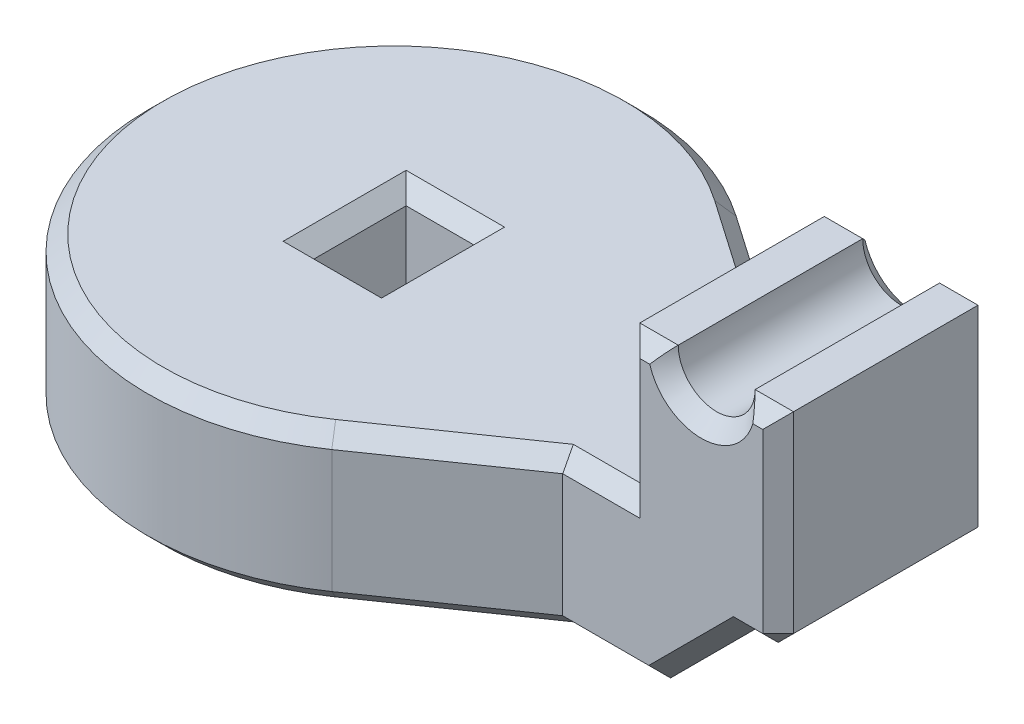
from build123d import *

# Parameters (mm, degrees)
SKETCH1_W           = 2.2
SKETCH1_H           = 3
BOSS_EXTRUDE1_DEPTH = 5
SKETCH3_W           = 5
SKETCH3_H           = 7
BOSS_EXTRUDE2_DEPTH = 1.5
SKETCH6_W           = 4
SKETCH6_H           = 7
CUT_EXTRUDE1_DEPTH  = 2.75
CHAMFER2_SIZE       = 2.75
SKETCH7_W           = 5
SKETCH7_H           = 7
BOSS_EXTRUDE3_DEPTH = 3
CUT_EXTRUDE2_DEPTH  = 21.32855135
BOSS_EXTRUDE4_START = -5
BOSS_EXTRUDE4_DEPTH = 5


# Some blends are built 0.0001 mm under size
with BuildPart() as part:
    # Sketch1 → Boss-Extrude1 (new body)
    with BuildSketch(Plane(origin=(0, 0, 0), x_dir=(1, 0, 0), z_dir=(0, 1, 0))):
        with BuildLine():
            Line((7.193747285, 3.5), (16, 3.5))
            Line((16, 3.5), (16, -3.5))
            Line((16, -3.5), (7.193747285, -3.5))
            ThreePointArc((7.193747285, -3.5), (-8, 0), (7.193747285, 3.5))
        make_face()
        Rectangle(SKETCH1_W, SKETCH1_H, mode=Mode.SUBTRACT)
    extrude(amount=-BOSS_EXTRUDE1_DEPTH)

    # Sketch3 → Boss-Extrude2 (add)
    with BuildSketch(Plane(origin=(0, 0, 0), x_dir=(1, 0, 0), z_dir=(0, 1, 0))):
        with Locations((13.5, 0)):
            Rectangle(SKETCH3_W, SKETCH3_H)
    extrude(amount=BOSS_EXTRUDE2_DEPTH)

    # Sketch6 → Cut-Extrude1 (cut)
    with BuildSketch(Plane.XZ.offset(5)):
        with Locations((14, 0)):
            Rectangle(SKETCH6_W, SKETCH6_H)
    extrude(amount=-CUT_EXTRUDE1_DEPTH, mode=Mode.SUBTRACT)

    # Chamfer2
    chamfer2_edges = [part.edges().sort_by_distance(p)[0] for p in [
        (12, -2.25, 0),
    ]]
    chamfer(chamfer2_edges, length=CHAMFER2_SIZE - 0.0001)  # a hair under: the kernel refuses the full size

    # Sketch7 → Boss-Extrude3 (add)
    with BuildSketch(Plane(origin=(0, 1.5, 0), x_dir=(1, 0, 0), z_dir=(0, 1, 0))):
        with Locations((13.5, 0)):
            Rectangle(SKETCH7_W, SKETCH7_H)
    extrude(amount=BOSS_EXTRUDE3_DEPTH)

    # Sketch8 → Cut-Extrude2 (cut, through all)
    with BuildSketch(Plane(origin=(0, 0, -3.5), x_dir=(-1, 0, 0), z_dir=(0, 0, -1))):
        with BuildLine():
            Line((-12.25, 4.5), (-14.75, 4.5))
            ThreePointArc((-14.75, 4.5), (-13.5, 3.25), (-12.25, 4.5))
        make_face()
    extrude(amount=-CUT_EXTRUDE2_DEPTH, mode=Mode.SUBTRACT)

    # Sketch9 → Boss-Extrude4 (add)
    with BuildSketch(Plane.XZ.offset(5).offset(BOSS_EXTRUDE4_START)):
        with BuildLine():
            Line((7.193747285, -3.5), (8.993747285, -3.5))
            Line((8.993747285, -3.5), (4.557329118, -6.575009605))
            ThreePointArc((4.557329118, -6.575009605), (6.073373871, -5.207122989), (7.193747285, -3.5))
        make_face()
        with BuildLine():
            Line((7.193747285, 3.5), (8.993747285, 3.5))
            Line((8.993747285, 3.5), (4.557329118, 6.575009605))
            ThreePointArc((4.557329118, 6.575009605), (6.073373871, 5.207122989), (7.193747285, 3.5))
        make_face()
    extrude(amount=BOSS_EXTRUDE4_DEPTH)

    # Chamfer3
    # the kernel refuses this chamfer: 0.5 mm, written as the material it takes off along each edge
    with BuildSketch(Plane(origin=(15.666666667, -1.916666667, 3.166666667), x_dir=(-0.7071067811865475, -0.7071067811865475, 0), z_dir=(0.5773502691896256, -0.5773502691896261, 0.5773502691896256))) as chamfer3_piece_1:
        Polygon((-0.353553391, 0.204124145), (0.353553391, 0.204124145), (0, -0.40824829), align=None)
    extrude(amount=0.635085296, mode=Mode.SUBTRACT)
    with BuildSketch(Plane(origin=(15.666666667, -1.916666667, -3.166666667), x_dir=(0.7071067811865478, 0, 0.7071067811865471), z_dir=(0.5773502691896256, -0.5773502691896256, -0.5773502691896261))) as chamfer3_piece_2:
        Polygon((-0.353553391, -0.204124145), (0.353553391, -0.204124145), (0, 0.40824829), align=None)
    extrude(amount=0.635085296, mode=Mode.SUBTRACT)
    with BuildSketch(Plane(origin=(-1.1, -5, 1.5), x_dir=(-0.9996219169112968, -0.027495876610585633, 0), z_dir=(0, 0, -1)), Plane(origin=(1.1, -5, -1.5), x_dir=(0.9996219169112968, -0.027495876610585633, 0), z_dir=(0, 0, 1))) as chamfer3_piece_3:
        with BuildLine():
            Line((0.514336598, 0), (-0.028273577, 0.513558897))
            Line((-0.028273577, 0.513558897), (-0.038269797, 0.513283938))
            ThreePointArc((-0.038269797, 0.513283938), (-0.017064614, 0.256698915), (-0.009996219, -0.000274959))
            Line((-0.009996219, -0.000274959), (0.000274959, -0.009996219))
            ThreePointArc((0.000274959, -0.009996219), (0.257248832, -0.002927825), (0.514611556, -0.009996219))
            Line((0.514611556, -0.009996219), (0.514336598, 0))
        make_face()
    extrude(amount=3, mode=Mode.SUBTRACT)
    with BuildSketch(Plane(origin=(-1.1, -5, -1.5), x_dir=(0, -0.027495876610585623, -0.9996219169112968), z_dir=(1, 0, 0)), Plane(origin=(1.1, -5, 1.5), x_dir=(0, -0.027495876610585623, 0.9996219169112968), z_dir=(-1, 0, 0))) as chamfer3_piece_4:
        with BuildLine():
            Line((0.514336598, 0), (-0.028273577, 0.513558897))
            Line((-0.028273577, 0.513558897), (-0.038269797, 0.513283938))
            ThreePointArc((-0.038269797, 0.513283938), (-0.017064614, 0.256698915), (-0.009996219, -0.000274959))
            Line((-0.009996219, -0.000274959), (0.000274959, -0.009996219))
            ThreePointArc((0.000274959, -0.009996219), (0.257248832, -0.002927825), (0.514611556, -0.009996219))
            Line((0.514611556, -0.009996219), (0.514336598, 0))
        make_face()
    extrude(amount=2.2, mode=Mode.SUBTRACT)
    with BuildSketch(Plane(origin=(-1.1, 0, 1.5), x_dir=(-0.9996219169112968, 0.027495876610586386, 0), z_dir=(0, 0, -1)), Plane(origin=(1.1, 0, -1.5), x_dir=(0.9996219169112968, 0.027495876610586386, 0), z_dir=(0, 0, 1))) as chamfer3_piece_5:
        with BuildLine():
            Line((0.514336598, 0), (-0.028273577, -0.513558897))
            Line((-0.028273577, -0.513558897), (-0.038269797, -0.513283938))
            ThreePointArc((-0.038269797, -0.513283938), (-0.017064614, -0.256698915), (-0.009996219, 0.000274959))
            Line((-0.009996219, 0.000274959), (0.000274959, 0.009996219))
            ThreePointArc((0.000274959, 0.009996219), (0.257248832, 0.002927825), (0.514611556, 0.009996219))
            Line((0.514611556, 0.009996219), (0.514336598, 0))
        make_face()
    extrude(amount=3, mode=Mode.SUBTRACT)
    with BuildSketch(Plane(origin=(1.1, 0, 1.5), x_dir=(0, 0.027495876610586365, 0.9996219169112968), z_dir=(-1, 0, 0)), Plane(origin=(-1.1, 0, -1.5), x_dir=(0, 0.027495876610586365, -0.9996219169112968), z_dir=(1, 0, 0))) as chamfer3_piece_6:
        with BuildLine():
            Line((0.514336598, 0), (-0.028273577, -0.513558897))
            Line((-0.028273577, -0.513558897), (-0.038269797, -0.513283938))
            ThreePointArc((-0.038269797, -0.513283938), (-0.017064614, -0.256698915), (-0.009996219, 0.000274959))
            Line((-0.009996219, 0.000274959), (0.000274959, 0.009996219))
            ThreePointArc((0.000274959, 0.009996219), (0.257248832, 0.002927825), (0.514611556, 0.009996219))
            Line((0.514611556, 0.009996219), (0.514336598, 0))
        make_face()
    extrude(amount=2.2, mode=Mode.SUBTRACT)
    with BuildSketch(Plane(origin=(7.707905791, 0, -3.5), x_dir=(0, -0.9996219169112968, -0.027495876610586494), z_dir=(1, 0, 0))) as chamfer3_piece_7_section:
        with BuildLine():
            Line((0.514336598, 0), (-0.028273577, -0.513558897))
            Line((-0.028273577, -0.513558897), (-0.038269797, -0.513283938))
            ThreePointArc((-0.038269797, -0.513283938), (-0.017064614, -0.256698915), (-0.009996219, 0.000274959))
            Line((-0.009996219, 0.000274959), (0.000274959, 0.009996219))
            ThreePointArc((0.000274959, 0.009996219), (0.257248832, 0.002927825), (0.514611556, 0.009996219))
            Line((0.514611556, 0.009996219), (0.514336598, 0))
        make_face()
    chamfer3_piece_7 = extrude(amount=3.292094209, mode=Mode.PRIVATE)
    chamfer3_piece_7 = split(chamfer3_piece_7, bisect_by=Plane(origin=(9.816517039, -0.171821198, -2.929714513), z_dir=(0.5696661397425643, 0, -0.8218762006718563)), keep=Keep.TOP, mode=Mode.PRIVATE)
    add(chamfer3_piece_7, mode=Mode.SUBTRACT)
    with BuildSketch(Plane(origin=(11, 0, -3.5), x_dir=(0.9996219169112968, 0, -0.027495876610587375), z_dir=(0, 1, 0)), Plane(origin=(11, 0, 3.5), x_dir=(-0.027495876610585647, 0, -0.9996219169112968), z_dir=(0, 1, 0))) as chamfer3_piece_8:
        with BuildLine():
            Line((0.514336598, 0), (-0.028273577, -0.513558897))
            Line((-0.028273577, -0.513558897), (-0.038269797, -0.513283938))
            ThreePointArc((-0.038269797, -0.513283938), (-0.017064614, -0.256698915), (-0.009996219, 0.000274959))
            Line((-0.009996219, 0.000274959), (0.000274959, 0.009996219))
            ThreePointArc((0.000274959, 0.009996219), (0.257248832, 0.002927825), (0.514611556, 0.009996219))
            Line((0.514611556, 0.009996219), (0.514336598, 0))
        make_face()
    extrude(amount=5.785841494, mode=Mode.SUBTRACT)
    with BuildSketch(Plane(origin=(7.707905791, -5, -3.5), x_dir=(0, 0.9996219169112968, -0.02749587661058651), z_dir=(1, 0, 0))) as chamfer3_piece_9_section:
        with BuildLine():
            Line((0.514336598, 0), (-0.028273577, 0.513558897))
            Line((-0.028273577, 0.513558897), (-0.038269797, 0.513283938))
            ThreePointArc((-0.038269797, 0.513283938), (-0.017064614, 0.256698915), (-0.009996219, -0.000274959))
            Line((-0.009996219, -0.000274959), (0.000274959, -0.009996219))
            ThreePointArc((0.000274959, -0.009996219), (0.257248832, -0.002927825), (0.514611556, -0.009996219))
            Line((0.514611556, -0.009996219), (0.514336598, 0))
        make_face()
    chamfer3_piece_9 = extrude(amount=5.577935703, mode=Mode.PRIVATE)
    chamfer3_piece_9 = split(chamfer3_piece_9, bisect_by=Plane(origin=(10.595515285, -4.83208292, -2.389768322), z_dir=(0.5696661397425643, 0, -0.8218762006718563)), keep=Keep.TOP, mode=Mode.PRIVATE)
    add(chamfer3_piece_9, mode=Mode.SUBTRACT)
    with BuildSketch(Plane(origin=(16, 5.785841494, 3.5), x_dir=(0.02749587661058907, 0, -0.9996219169112965), z_dir=(0, -1, 0)), Plane(origin=(16, 5.785841494, -3.5), x_dir=(-0.9996219169112968, 0, -0.02749587661058651), z_dir=(0, -1, 0))) as chamfer3_piece_10:
        with BuildLine():
            Line((0.514336598, 0), (-0.028273577, -0.513558897))
            Line((-0.028273577, -0.513558897), (-0.038269797, -0.513283938))
            ThreePointArc((-0.038269797, -0.513283938), (-0.017064614, -0.256698915), (-0.009996219, 0.000274959))
            Line((-0.009996219, 0.000274959), (0.000274959, 0.009996219))
            ThreePointArc((0.000274959, 0.009996219), (0.257248832, 0.002927825), (0.514611556, 0.009996219))
            Line((0.514611556, 0.009996219), (0.514336598, 0))
        make_face()
    extrude(amount=9.321682988, mode=Mode.SUBTRACT)
    with BuildSketch(Plane(origin=(16, -2.25, 4.785841494), x_dir=(0.02749587661058907, 0.9996219169112965, 0), z_dir=(0, 0, -1))) as chamfer3_piece_11:
        with BuildLine():
            Line((0.514336598, 0), (-0.028273577, -0.513558897))
            Line((-0.028273577, -0.513558897), (-0.038269797, -0.513283938))
            ThreePointArc((-0.038269797, -0.513283938), (-0.017064614, -0.256698915), (-0.009996219, 0.000274959))
            Line((-0.009996219, 0.000274959), (0.000274959, 0.009996219))
            ThreePointArc((0.000274959, 0.009996219), (0.257248832, 0.002927825), (0.514611556, 0.009996219))
            Line((0.514611556, 0.009996219), (0.514336598, 0))
        make_face()
    extrude(amount=9.571682988, mode=Mode.SUBTRACT)
    with BuildSketch(Plane(origin=(13.464058506, -2.25, 3.5), x_dir=(0, -0.027495876610586487, -0.9996219169112968), z_dir=(1, 0, 0))) as chamfer3_piece_12_section:
        with BuildLine():
            Line((0.514336598, 0), (-0.028273577, 0.513558897))
            Line((-0.028273577, 0.513558897), (-0.038269797, 0.513283938))
            ThreePointArc((-0.038269797, 0.513283938), (-0.017064614, 0.256698915), (-0.009996219, -0.000274959))
            Line((-0.009996219, -0.000274959), (0.000274959, -0.009996219))
            ThreePointArc((0.000274959, -0.009996219), (0.257248832, -0.002927825), (0.514611556, -0.009996219))
            Line((0.514611556, -0.009996219), (0.514336598, 0))
        make_face()
    chamfer3_piece_12 = extrude(amount=3.821782988, mode=Mode.PRIVATE)
    chamfer3_piece_12 = split(chamfer3_piece_12, bisect_by=Plane(origin=(15.502536262, -1.497363738, 3.331523674), z_dir=(0.7071067811865476, -0.7071067811865476, 0)), keep=Keep.TOP, mode=Mode.PRIVATE)
    add(chamfer3_piece_12, mode=Mode.SUBTRACT)
    with BuildSketch(Plane(origin=(17.285841494, -2.25, -3.5), x_dir=(0, 0.9996219169112968, -0.027495876610586487), z_dir=(-1, 0, 0))) as chamfer3_piece_13_section:
        with BuildLine():
            Line((0.514336598, 0), (-0.028273577, -0.513558897))
            Line((-0.028273577, -0.513558897), (-0.038269797, -0.513283938))
            ThreePointArc((-0.038269797, -0.513283938), (-0.017064614, -0.256698915), (-0.009996219, 0.000274959))
            Line((-0.009996219, 0.000274959), (0.000274959, 0.009996219))
            ThreePointArc((0.000274959, 0.009996219), (0.257248832, 0.002927825), (0.514611556, 0.009996219))
            Line((0.514611556, 0.009996219), (0.514336598, 0))
        make_face()
    chamfer3_piece_13 = extrude(amount=3.821782988, mode=Mode.PRIVATE)
    chamfer3_piece_13 = split(chamfer3_piece_13, bisect_by=Plane(origin=(15.502536262, -1.497363738, -3.331523674), z_dir=(0.7071067811865476, -0.7071067811865476, 0)), keep=Keep.TOP, mode=Mode.PRIVATE)
    add(chamfer3_piece_13, mode=Mode.SUBTRACT)
    with BuildSketch(Plane(origin=(15.65912724, -1.34077276, -3.5), x_dir=(-0.7068394360706736, 0.7068394360706736, -0.027495876610586528), z_dir=(-0.7071067811865476, -0.7071067811865476, 0))) as chamfer3_piece_14_section:
        with BuildLine():
            Line((0.514336598, 0), (-0.028273577, -0.513558897))
            Line((-0.028273577, -0.513558897), (-0.038269797, -0.513283938))
            ThreePointArc((-0.038269797, -0.513283938), (-0.017064614, -0.256698915), (-0.009996219, 0.000274959))
            Line((-0.009996219, 0.000274959), (0.000274959, 0.009996219))
            ThreePointArc((0.000274959, 0.009996219), (0.257248832, 0.002927825), (0.514611556, 0.009996219))
            Line((0.514611556, 0.009996219), (0.514336598, 0))
        make_face()
    chamfer3_piece_14 = extrude(amount=6.460628863, mode=Mode.PRIVATE)
    chamfer3_piece_14 = split(chamfer3_piece_14, bisect_by=Plane(origin=(13.264658459, -2.25, -3.33033397), z_dir=(0, -1, 0)), keep=Keep.TOP, mode=Mode.PRIVATE)
    add(chamfer3_piece_14, mode=Mode.SUBTRACT)
    with BuildSketch(Plane(origin=(15.65912724, -1.34077276, 3.5), x_dir=(0.019442520806014007, -0.019442520806014007, -0.9996219169112968), z_dir=(-0.7071067811865476, -0.7071067811865476, 0))) as chamfer3_piece_15_section:
        with BuildLine():
            Line((0.514336598, 0), (-0.028273577, -0.513558897))
            Line((-0.028273577, -0.513558897), (-0.038269797, -0.513283938))
            ThreePointArc((-0.038269797, -0.513283938), (-0.017064614, -0.256698915), (-0.009996219, 0.000274959))
            Line((-0.009996219, 0.000274959), (0.000274959, 0.009996219))
            ThreePointArc((0.000274959, 0.009996219), (0.257248832, 0.002927825), (0.514611556, 0.009996219))
            Line((0.514611556, 0.009996219), (0.514336598, 0))
        make_face()
    chamfer3_piece_15 = extrude(amount=6.460628863, mode=Mode.PRIVATE)
    chamfer3_piece_15 = split(chamfer3_piece_15, bisect_by=Plane(origin=(13.264658459, -2.25, 3.33033397), z_dir=(0, -1, 0)), keep=Keep.TOP, mode=Mode.PRIVATE)
    add(chamfer3_piece_15, mode=Mode.SUBTRACT)
    with BuildSketch(Plane(origin=(13.535841494, 4.5, 3.5), x_dir=(0, 0.027495876610585623, -0.9996219169112968), z_dir=(-1, 0, 0)), Plane(origin=(17.285841494, 4.5, 3.5), x_dir=(0, 0.027495876610585623, -0.9996219169112968), z_dir=(-1, 0, 0))) as chamfer3_piece_16:
        with BuildLine():
            Line((0.514336598, 0), (-0.028273577, 0.513558897))
            Line((-0.028273577, 0.513558897), (-0.038269797, 0.513283938))
            ThreePointArc((-0.038269797, 0.513283938), (-0.017064614, 0.256698915), (-0.009996219, -0.000274959))
            Line((-0.009996219, -0.000274959), (0.000274959, -0.009996219))
            ThreePointArc((0.000274959, -0.009996219), (0.257248832, -0.002927825), (0.514611556, -0.009996219))
            Line((0.514611556, -0.009996219), (0.514336598, 0))
        make_face()
    extrude(amount=3.821682988, mode=Mode.SUBTRACT)
    with BuildSketch(Plane(origin=(13.464158506, 4.5, -3.5), x_dir=(0, -0.9996219169112968, -0.027495876610586487), z_dir=(1, 0, 0)), Plane(origin=(9.714158506, 4.5, -3.5), x_dir=(0, -0.9996219169112968, -0.027495876610586487), z_dir=(1, 0, 0))) as chamfer3_piece_17:
        with BuildLine():
            Line((0.514336598, 0), (-0.028273577, -0.513558897))
            Line((-0.028273577, -0.513558897), (-0.038269797, -0.513283938))
            ThreePointArc((-0.038269797, -0.513283938), (-0.017064614, -0.256698915), (-0.009996219, 0.000274959))
            Line((-0.009996219, 0.000274959), (0.000274959, 0.009996219))
            ThreePointArc((0.000274959, 0.009996219), (0.257248832, 0.002927825), (0.514611556, 0.009996219))
            Line((0.514611556, 0.009996219), (0.514336598, 0))
        make_face()
    extrude(amount=3.821682988, mode=Mode.SUBTRACT)
    with BuildSketch(Plane(origin=(13.5, 4.5, 3.5), x_dir=(0.5145380552143337, 0.8574675444215083, 0), z_dir=(-0.8574675444215083, 0.5145380552143337, 0))) as chamfer3_piece_18:
        with BuildLine():
            Line((1.235857864, 0.514142136), (1.764142136, -0.014142136))
            Line((1.764142136, -0.014142136), (1.764142136, -0.024142136))
            ThreePointArc((1.764142136, -0.024142136), (1.507071068, -0.01), (1.25, -0.01))
            Line((1.25, -0.01), (1.24, 0))
            ThreePointArc((1.24, 0), (1.24, 0.257071068), (1.225857864, 0.514142136))
            Line((1.225857864, 0.514142136), (1.235857864, 0.514142136))
        make_face()
    revolve(axis=Axis((13.5, 4.5, 3.5), (0, 0, -1)), revolution_arc=298.066834096, mode=Mode.SUBTRACT)
    with BuildSketch(Plane(origin=(13.5, 4.5, -3.5), x_dir=(0.5145380552143337, 0.8574675444215083, 0), z_dir=(-0.8574675444215083, 0.5145380552143337, 0))) as chamfer3_piece_19:
        with BuildLine():
            Line((1.764142136, 0.014142136), (1.235857864, -0.514142136))
            Line((1.235857864, -0.514142136), (1.225857864, -0.514142136))
            ThreePointArc((1.225857864, -0.514142136), (1.24, -0.257071068), (1.24, 0))
            Line((1.24, 0), (1.25, 0.01))
            ThreePointArc((1.25, 0.01), (1.507071068, 0.01), (1.764142136, 0.024142136))
            Line((1.764142136, 0.024142136), (1.764142136, 0.014142136))
        make_face()
    revolve(axis=Axis((13.5, 4.5, -3.5), (0, 0, -1)), revolution_arc=298.066834096, mode=Mode.SUBTRACT)
    with BuildSketch(Plane(origin=(0, 0, 0), x_dir=(0.5696661397425641, 0, 0.8218762006718563), z_dir=(0.8218762006718563, 0, -0.5696661397425641))) as chamfer3_piece_20:
        with BuildLine():
            Line((7.485857864, -0.014142136), (8.014142136, 0.514142136))
            Line((8.014142136, 0.514142136), (8.024142136, 0.514142136))
            ThreePointArc((8.024142136, 0.514142136), (8.01, 0.257071068), (8.01, 0))
            Line((8.01, 0), (8, -0.01))
            ThreePointArc((8, -0.01), (7.742928932, -0.01), (7.485857864, -0.024142136))
            Line((7.485857864, -0.024142136), (7.485857864, -0.014142136))
        make_face()
    revolve(axis=Axis((0, 0, 0), (0, -1, 0)), revolution_arc=249.453895888, mode=Mode.SUBTRACT)
    with BuildSketch(Plane(origin=(0, -5, 0), x_dir=(0.5696661397425641, 0, 0.8218762006718563), z_dir=(0.8218762006718563, 0, -0.5696661397425641))) as chamfer3_piece_21:
        with BuildLine():
            Line((7.485857864, 0.014142136), (8.014142136, -0.514142136))
            Line((8.014142136, -0.514142136), (8.024142136, -0.514142136))
            ThreePointArc((8.024142136, -0.514142136), (8.01, -0.257071068), (8.01, 0))
            Line((8.01, 0), (8, 0.01))
            ThreePointArc((8, 0.01), (7.742928932, 0.01), (7.485857864, 0.024142136))
            Line((7.485857864, 0.024142136), (7.485857864, 0.014142136))
        make_face()
    revolve(axis=Axis((0, -5, 0), (0, -1, 0)), revolution_arc=249.453895888, mode=Mode.SUBTRACT)
    with BuildSketch(Plane(origin=(10.050549807, -5, -2.76749964), x_dir=(-0.5694507586089208, -0.02749587661058559, 0.8215654631793746), z_dir=(-0.8218762006718563, 0, -0.5696661397425643))) as chamfer3_piece_22_section:
        with BuildLine():
            Line((0.514336598, 0), (-0.028273577, 0.513558897))
            Line((-0.028273577, 0.513558897), (-0.038269797, 0.513283938))
            ThreePointArc((-0.038269797, 0.513283938), (-0.017064614, 0.256698915), (-0.009996219, -0.000274959))
            Line((-0.009996219, -0.000274959), (0.000274959, -0.009996219))
            ThreePointArc((0.000274959, -0.009996219), (0.257248832, -0.002927825), (0.514611556, -0.009996219))
            Line((0.514611556, -0.009996219), (0.514336598, 0))
        make_face()
    chamfer3_piece_22 = extrude(amount=6.683756853, mode=Mode.PRIVATE)
    chamfer3_piece_22 = split(chamfer3_piece_22, bisect_by=Plane(origin=(6.588999328, -4.832730181, -3.5), z_dir=(0, 0, -1)), keep=Keep.TOP, mode=Mode.PRIVATE)
    add(chamfer3_piece_22, mode=Mode.SUBTRACT)
    with BuildSketch(Plane(origin=(10.050549807, 0, -2.76749964), x_dir=(0.01566346988759034, -0.9996219169112968, -0.022598206602850505), z_dir=(-0.8218762006718563, 0, -0.5696661397425643))) as chamfer3_piece_23_section:
        with BuildLine():
            Line((0.514336598, 0), (-0.028273577, 0.513558897))
            Line((-0.028273577, 0.513558897), (-0.038269797, 0.513283938))
            ThreePointArc((-0.038269797, 0.513283938), (-0.017064614, 0.256698915), (-0.009996219, -0.000274959))
            Line((-0.009996219, -0.000274959), (0.000274959, -0.009996219))
            ThreePointArc((0.000274959, -0.009996219), (0.257248832, -0.002927825), (0.514611556, -0.009996219))
            Line((0.514611556, -0.009996219), (0.514336598, 0))
        make_face()
    chamfer3_piece_23 = extrude(amount=6.683756853, mode=Mode.PRIVATE)
    chamfer3_piece_23 = split(chamfer3_piece_23, bisect_by=Plane(origin=(6.588999328, -0.167269819, -3.5), z_dir=(0, 0, -1)), keep=Keep.TOP, mode=Mode.PRIVATE)
    add(chamfer3_piece_23, mode=Mode.SUBTRACT)
    with BuildSketch(Plane(origin=(11, 0, 3.5), x_dir=(0, 0.027495876610586365, -0.9996219169112968), z_dir=(-1, 0, 0))) as chamfer3_piece_24_section:
        with BuildLine():
            Line((0.514336598, 0), (-0.028273577, 0.513558897))
            Line((-0.028273577, 0.513558897), (-0.038269797, 0.513283938))
            ThreePointArc((-0.038269797, 0.513283938), (-0.017064614, 0.256698915), (-0.009996219, -0.000274959))
            Line((-0.009996219, -0.000274959), (0.000274959, -0.009996219))
            ThreePointArc((0.000274959, -0.009996219), (0.257248832, -0.002927825), (0.514611556, -0.009996219))
            Line((0.514611556, -0.009996219), (0.514336598, 0))
        make_face()
    chamfer3_piece_24 = extrude(amount=3.292094209, mode=Mode.PRIVATE)
    chamfer3_piece_24 = split(chamfer3_piece_24, bisect_by=Plane(origin=(9.816517039, -0.171821198, 2.929714513), z_dir=(0.5696661397425644, 0, 0.8218762006718561)), keep=Keep.TOP, mode=Mode.PRIVATE)
    add(chamfer3_piece_24, mode=Mode.SUBTRACT)
    with BuildSketch(Plane(origin=(13.285841494, -5, 3.5), x_dir=(0, -0.027495876610585623, -0.9996219169112968), z_dir=(-1, 0, 0))) as chamfer3_piece_25_section:
        with BuildLine():
            Line((0.514336598, 0), (-0.028273577, -0.513558897))
            Line((-0.028273577, -0.513558897), (-0.038269797, -0.513283938))
            ThreePointArc((-0.038269797, -0.513283938), (-0.017064614, -0.256698915), (-0.009996219, 0.000274959))
            Line((-0.009996219, 0.000274959), (0.000274959, 0.009996219))
            ThreePointArc((0.000274959, 0.009996219), (0.257248832, 0.002927825), (0.514611556, 0.009996219))
            Line((0.514611556, 0.009996219), (0.514336598, 0))
        make_face()
    chamfer3_piece_25 = extrude(amount=5.577935703, mode=Mode.PRIVATE)
    chamfer3_piece_25 = split(chamfer3_piece_25, bisect_by=Plane(origin=(10.595515285, -4.83208292, 2.389768322), z_dir=(0.5696661397425644, 0, 0.8218762006718561)), keep=Keep.TOP, mode=Mode.PRIVATE)
    add(chamfer3_piece_25, mode=Mode.SUBTRACT)
    with BuildSketch(Plane(origin=(10.050549807, -5, 2.76749964), x_dir=(-0.5694507586089209, -0.027495876610585612, -0.8215654631793744), z_dir=(-0.8218762006718561, 0, 0.5696661397425644))) as chamfer3_piece_26_section:
        with BuildLine():
            Line((0.514336598, 0), (-0.028273577, -0.513558897))
            Line((-0.028273577, -0.513558897), (-0.038269797, -0.513283938))
            ThreePointArc((-0.038269797, -0.513283938), (-0.017064614, -0.256698915), (-0.009996219, 0.000274959))
            Line((-0.009996219, 0.000274959), (0.000274959, 0.009996219))
            ThreePointArc((0.000274959, 0.009996219), (0.257248832, 0.002927825), (0.514611556, 0.009996219))
            Line((0.514611556, 0.009996219), (0.514336598, 0))
        make_face()
    chamfer3_piece_26 = extrude(amount=6.683756853, mode=Mode.PRIVATE)
    chamfer3_piece_26 = split(chamfer3_piece_26, bisect_by=Plane(origin=(6.588999328, -4.832730181, 3.5), z_dir=(0, 0, 1)), keep=Keep.TOP, mode=Mode.PRIVATE)
    add(chamfer3_piece_26, mode=Mode.SUBTRACT)
    with BuildSketch(Plane(origin=(10.050549807, 0, 2.76749964), x_dir=(-0.5694507586089208, 0.027495876610586344, -0.8215654631793742), z_dir=(-0.8218762006718561, 0, 0.5696661397425644))) as chamfer3_piece_27_section:
        with BuildLine():
            Line((0.514336598, 0), (-0.028273577, 0.513558897))
            Line((-0.028273577, 0.513558897), (-0.038269797, 0.513283938))
            ThreePointArc((-0.038269797, 0.513283938), (-0.017064614, 0.256698915), (-0.009996219, -0.000274959))
            Line((-0.009996219, -0.000274959), (0.000274959, -0.009996219))
            ThreePointArc((0.000274959, -0.009996219), (0.257248832, -0.002927825), (0.514611556, -0.009996219))
            Line((0.514611556, -0.009996219), (0.514336598, 0))
        make_face()
    chamfer3_piece_27 = extrude(amount=6.683756853, mode=Mode.PRIVATE)
    chamfer3_piece_27 = split(chamfer3_piece_27, bisect_by=Plane(origin=(6.588999328, -0.167269819, 3.5), z_dir=(0, 0, 1)), keep=Keep.TOP, mode=Mode.PRIVATE)
    add(chamfer3_piece_27, mode=Mode.SUBTRACT)
    with BuildSketch(Plane(origin=(-1.1, -5, 2.785841494), x_dir=(-0.9996219169112968, -0.027495876610585623, 0), z_dir=(0, 0, -1))) as chamfer3_piece_28a_section:
        with BuildLine():
            Line((0.514336598, 0), (-0.028273577, 0.513558897))
            Line((-0.028273577, 0.513558897), (-0.038269797, 0.513283938))
            ThreePointArc((-0.038269797, 0.513283938), (-0.017064614, 0.256698915), (-0.009996219, -0.000274959))
            Line((-0.009996219, -0.000274959), (0.000274959, -0.009996219))
            ThreePointArc((0.000274959, -0.009996219), (0.257248832, -0.002927825), (0.514611556, -0.009996219))
            Line((0.514611556, -0.009996219), (0.514336598, 0))
        make_face()
    chamfer3_piece_28a = extrude(amount=4.285841494, mode=Mode.PRIVATE)
    chamfer3_piece_28a = split(chamfer3_piece_28a, bisect_by=Plane(origin=(-1.264896813, -4.835103187, 1.5), z_dir=(0, 0, 1)), keep=Keep.TOP, mode=Mode.PRIVATE)
    with BuildSketch(Plane(origin=(1.1, -5, 1.5), x_dir=(0, -0.027495876610585623, 0.9996219169112968), z_dir=(-1, 0, 0))) as chamfer3_piece_28b_section:
        with BuildLine():
            Line((0.514336598, 0), (-0.028273577, 0.513558897))
            Line((-0.028273577, 0.513558897), (-0.038269797, 0.513283938))
            ThreePointArc((-0.038269797, 0.513283938), (-0.017064614, 0.256698915), (-0.009996219, -0.000274959))
            Line((-0.009996219, -0.000274959), (0.000274959, -0.009996219))
            ThreePointArc((0.000274959, -0.009996219), (0.257248832, -0.002927825), (0.514611556, -0.009996219))
            Line((0.514611556, -0.009996219), (0.514336598, 0))
        make_face()
    chamfer3_piece_28b = extrude(amount=3.485841494, mode=Mode.PRIVATE)
    chamfer3_piece_28b = split(chamfer3_piece_28b, bisect_by=Plane(origin=(-1.1, -4.835103187, 1.664896813), z_dir=(-1, 0, 0)), keep=Keep.TOP, mode=Mode.PRIVATE)
    chamfer3_piece_28 = chamfer3_piece_28a & chamfer3_piece_28b
    add(chamfer3_piece_28, mode=Mode.SUBTRACT)
    with BuildSketch(Plane(origin=(-2.385841494, -5, -1.5), x_dir=(0, -0.027495876610585623, -0.9996219169112968), z_dir=(1, 0, 0))) as chamfer3_piece_29a_section:
        with BuildLine():
            Line((0.514336598, 0), (-0.028273577, 0.513558897))
            Line((-0.028273577, 0.513558897), (-0.038269797, 0.513283938))
            ThreePointArc((-0.038269797, 0.513283938), (-0.017064614, 0.256698915), (-0.009996219, -0.000274959))
            Line((-0.009996219, -0.000274959), (0.000274959, -0.009996219))
            ThreePointArc((0.000274959, -0.009996219), (0.257248832, -0.002927825), (0.514611556, -0.009996219))
            Line((0.514611556, -0.009996219), (0.514336598, 0))
        make_face()
    chamfer3_piece_29a = extrude(amount=3.485841494, mode=Mode.PRIVATE)
    chamfer3_piece_29a = split(chamfer3_piece_29a, bisect_by=Plane(origin=(-1.1, -4.835103187, -1.664896813), z_dir=(-1, 0, 0)), keep=Keep.TOP, mode=Mode.PRIVATE)
    with BuildSketch(Plane(origin=(-1.1, -5, 1.5), x_dir=(-0.9996219169112968, -0.027495876610585633, 0), z_dir=(0, 0, -1))) as chamfer3_piece_29b_section:
        with BuildLine():
            Line((0.514336598, 0), (-0.028273577, 0.513558897))
            Line((-0.028273577, 0.513558897), (-0.038269797, 0.513283938))
            ThreePointArc((-0.038269797, 0.513283938), (-0.017064614, 0.256698915), (-0.009996219, -0.000274959))
            Line((-0.009996219, -0.000274959), (0.000274959, -0.009996219))
            ThreePointArc((0.000274959, -0.009996219), (0.257248832, -0.002927825), (0.514611556, -0.009996219))
            Line((0.514611556, -0.009996219), (0.514336598, 0))
        make_face()
    chamfer3_piece_29b = extrude(amount=4.285841494, mode=Mode.PRIVATE)
    chamfer3_piece_29b = split(chamfer3_piece_29b, bisect_by=Plane(origin=(-1.264896813, -4.835103187, -1.5), z_dir=(0, 0, -1)), keep=Keep.TOP, mode=Mode.PRIVATE)
    chamfer3_piece_29 = chamfer3_piece_29a & chamfer3_piece_29b
    add(chamfer3_piece_29, mode=Mode.SUBTRACT)
    with BuildSketch(Plane(origin=(1.1, -5, -2.785841494), x_dir=(0.9996219169112968, -0.027495876610585623, 0), z_dir=(0, 0, 1))) as chamfer3_piece_30a_section:
        with BuildLine():
            Line((0.514336598, 0), (-0.028273577, 0.513558897))
            Line((-0.028273577, 0.513558897), (-0.038269797, 0.513283938))
            ThreePointArc((-0.038269797, 0.513283938), (-0.017064614, 0.256698915), (-0.009996219, -0.000274959))
            Line((-0.009996219, -0.000274959), (0.000274959, -0.009996219))
            ThreePointArc((0.000274959, -0.009996219), (0.257248832, -0.002927825), (0.514611556, -0.009996219))
            Line((0.514611556, -0.009996219), (0.514336598, 0))
        make_face()
    chamfer3_piece_30a = extrude(amount=4.285841494, mode=Mode.PRIVATE)
    chamfer3_piece_30a = split(chamfer3_piece_30a, bisect_by=Plane(origin=(1.264896813, -4.835103187, -1.5), z_dir=(0, 0, -1)), keep=Keep.TOP, mode=Mode.PRIVATE)
    with BuildSketch(Plane(origin=(-1.1, -5, -1.5), x_dir=(0, -0.027495876610585623, -0.9996219169112968), z_dir=(1, 0, 0))) as chamfer3_piece_30b_section:
        with BuildLine():
            Line((0.514336598, 0), (-0.028273577, 0.513558897))
            Line((-0.028273577, 0.513558897), (-0.038269797, 0.513283938))
            ThreePointArc((-0.038269797, 0.513283938), (-0.017064614, 0.256698915), (-0.009996219, -0.000274959))
            Line((-0.009996219, -0.000274959), (0.000274959, -0.009996219))
            ThreePointArc((0.000274959, -0.009996219), (0.257248832, -0.002927825), (0.514611556, -0.009996219))
            Line((0.514611556, -0.009996219), (0.514336598, 0))
        make_face()
    chamfer3_piece_30b = extrude(amount=3.485841494, mode=Mode.PRIVATE)
    chamfer3_piece_30b = split(chamfer3_piece_30b, bisect_by=Plane(origin=(1.1, -4.835103187, -1.664896813), z_dir=(1, 0, 0)), keep=Keep.TOP, mode=Mode.PRIVATE)
    chamfer3_piece_30 = chamfer3_piece_30a & chamfer3_piece_30b
    add(chamfer3_piece_30, mode=Mode.SUBTRACT)
    with BuildSketch(Plane(origin=(1.1, -5, -1.5), x_dir=(0.9996219169112968, -0.027495876610585633, 0), z_dir=(0, 0, 1))) as chamfer3_piece_31a_section:
        with BuildLine():
            Line((0.514336598, 0), (-0.028273577, 0.513558897))
            Line((-0.028273577, 0.513558897), (-0.038269797, 0.513283938))
            ThreePointArc((-0.038269797, 0.513283938), (-0.017064614, 0.256698915), (-0.009996219, -0.000274959))
            Line((-0.009996219, -0.000274959), (0.000274959, -0.009996219))
            ThreePointArc((0.000274959, -0.009996219), (0.257248832, -0.002927825), (0.514611556, -0.009996219))
            Line((0.514611556, -0.009996219), (0.514336598, 0))
        make_face()
    chamfer3_piece_31a = extrude(amount=4.285841494, mode=Mode.PRIVATE)
    chamfer3_piece_31a = split(chamfer3_piece_31a, bisect_by=Plane(origin=(1.264896813, -4.835103187, 1.5), z_dir=(0, 0, 1)), keep=Keep.TOP, mode=Mode.PRIVATE)
    with BuildSketch(Plane(origin=(2.385841494, -5, 1.5), x_dir=(0, -0.027495876610585623, 0.9996219169112968), z_dir=(-1, 0, 0))) as chamfer3_piece_31b_section:
        with BuildLine():
            Line((0.514336598, 0), (-0.028273577, 0.513558897))
            Line((-0.028273577, 0.513558897), (-0.038269797, 0.513283938))
            ThreePointArc((-0.038269797, 0.513283938), (-0.017064614, 0.256698915), (-0.009996219, -0.000274959))
            Line((-0.009996219, -0.000274959), (0.000274959, -0.009996219))
            ThreePointArc((0.000274959, -0.009996219), (0.257248832, -0.002927825), (0.514611556, -0.009996219))
            Line((0.514611556, -0.009996219), (0.514336598, 0))
        make_face()
    chamfer3_piece_31b = extrude(amount=3.485841494, mode=Mode.PRIVATE)
    chamfer3_piece_31b = split(chamfer3_piece_31b, bisect_by=Plane(origin=(1.1, -4.835103187, 1.664896813), z_dir=(1, 0, 0)), keep=Keep.TOP, mode=Mode.PRIVATE)
    chamfer3_piece_31 = chamfer3_piece_31a & chamfer3_piece_31b
    add(chamfer3_piece_31, mode=Mode.SUBTRACT)
    with BuildSketch(Plane(origin=(-1.1, 0, 2.785841494), x_dir=(-0.9996219169112968, 0.027495876610586376, 0), z_dir=(0, 0, -1))) as chamfer3_piece_32a_section:
        with BuildLine():
            Line((0.514336598, 0), (-0.028273577, -0.513558897))
            Line((-0.028273577, -0.513558897), (-0.038269797, -0.513283938))
            ThreePointArc((-0.038269797, -0.513283938), (-0.017064614, -0.256698915), (-0.009996219, 0.000274959))
            Line((-0.009996219, 0.000274959), (0.000274959, 0.009996219))
            ThreePointArc((0.000274959, 0.009996219), (0.257248832, 0.002927825), (0.514611556, 0.009996219))
            Line((0.514611556, 0.009996219), (0.514336598, 0))
        make_face()
    chamfer3_piece_32a = extrude(amount=4.285841494, mode=Mode.PRIVATE)
    chamfer3_piece_32a = split(chamfer3_piece_32a, bisect_by=Plane(origin=(-1.264896813, -0.164896813, 1.5), z_dir=(0, 0, 1)), keep=Keep.TOP, mode=Mode.PRIVATE)
    with BuildSketch(Plane(origin=(1.1, 0, 1.5), x_dir=(0, 0.027495876610586365, 0.9996219169112968), z_dir=(-1, 0, 0))) as chamfer3_piece_32b_section:
        with BuildLine():
            Line((0.514336598, 0), (-0.028273577, -0.513558897))
            Line((-0.028273577, -0.513558897), (-0.038269797, -0.513283938))
            ThreePointArc((-0.038269797, -0.513283938), (-0.017064614, -0.256698915), (-0.009996219, 0.000274959))
            Line((-0.009996219, 0.000274959), (0.000274959, 0.009996219))
            ThreePointArc((0.000274959, 0.009996219), (0.257248832, 0.002927825), (0.514611556, 0.009996219))
            Line((0.514611556, 0.009996219), (0.514336598, 0))
        make_face()
    chamfer3_piece_32b = extrude(amount=3.485841494, mode=Mode.PRIVATE)
    chamfer3_piece_32b = split(chamfer3_piece_32b, bisect_by=Plane(origin=(-1.1, -0.164896813, 1.664896813), z_dir=(-1, 0, 0)), keep=Keep.TOP, mode=Mode.PRIVATE)
    chamfer3_piece_32 = chamfer3_piece_32a & chamfer3_piece_32b
    add(chamfer3_piece_32, mode=Mode.SUBTRACT)
    with BuildSketch(Plane(origin=(-2.385841494, 0, -1.5), x_dir=(0, 0.027495876610586365, -0.9996219169112968), z_dir=(1, 0, 0))) as chamfer3_piece_33a_section:
        with BuildLine():
            Line((0.514336598, 0), (-0.028273577, -0.513558897))
            Line((-0.028273577, -0.513558897), (-0.038269797, -0.513283938))
            ThreePointArc((-0.038269797, -0.513283938), (-0.017064614, -0.256698915), (-0.009996219, 0.000274959))
            Line((-0.009996219, 0.000274959), (0.000274959, 0.009996219))
            ThreePointArc((0.000274959, 0.009996219), (0.257248832, 0.002927825), (0.514611556, 0.009996219))
            Line((0.514611556, 0.009996219), (0.514336598, 0))
        make_face()
    chamfer3_piece_33a = extrude(amount=3.485841494, mode=Mode.PRIVATE)
    chamfer3_piece_33a = split(chamfer3_piece_33a, bisect_by=Plane(origin=(-1.1, -0.164896813, -1.664896813), z_dir=(-1, 0, 0)), keep=Keep.TOP, mode=Mode.PRIVATE)
    with BuildSketch(Plane(origin=(-1.1, 0, 1.5), x_dir=(-0.9996219169112968, 0.027495876610586386, 0), z_dir=(0, 0, -1))) as chamfer3_piece_33b_section:
        with BuildLine():
            Line((0.514336598, 0), (-0.028273577, -0.513558897))
            Line((-0.028273577, -0.513558897), (-0.038269797, -0.513283938))
            ThreePointArc((-0.038269797, -0.513283938), (-0.017064614, -0.256698915), (-0.009996219, 0.000274959))
            Line((-0.009996219, 0.000274959), (0.000274959, 0.009996219))
            ThreePointArc((0.000274959, 0.009996219), (0.257248832, 0.002927825), (0.514611556, 0.009996219))
            Line((0.514611556, 0.009996219), (0.514336598, 0))
        make_face()
    chamfer3_piece_33b = extrude(amount=4.285841494, mode=Mode.PRIVATE)
    chamfer3_piece_33b = split(chamfer3_piece_33b, bisect_by=Plane(origin=(-1.264896813, -0.164896813, -1.5), z_dir=(0, 0, -1)), keep=Keep.TOP, mode=Mode.PRIVATE)
    chamfer3_piece_33 = chamfer3_piece_33a & chamfer3_piece_33b
    add(chamfer3_piece_33, mode=Mode.SUBTRACT)
    with BuildSketch(Plane(origin=(1.1, 0, -1.5), x_dir=(0.9996219169112968, 0.027495876610586386, 0), z_dir=(0, 0, 1))) as chamfer3_piece_34a_section:
        with BuildLine():
            Line((0.514336598, 0), (-0.028273577, -0.513558897))
            Line((-0.028273577, -0.513558897), (-0.038269797, -0.513283938))
            ThreePointArc((-0.038269797, -0.513283938), (-0.017064614, -0.256698915), (-0.009996219, 0.000274959))
            Line((-0.009996219, 0.000274959), (0.000274959, 0.009996219))
            ThreePointArc((0.000274959, 0.009996219), (0.257248832, 0.002927825), (0.514611556, 0.009996219))
            Line((0.514611556, 0.009996219), (0.514336598, 0))
        make_face()
    chamfer3_piece_34a = extrude(amount=4.285841494, mode=Mode.PRIVATE)
    chamfer3_piece_34a = split(chamfer3_piece_34a, bisect_by=Plane(origin=(1.264896813, -0.164896813, 1.5), z_dir=(0, 0, 1)), keep=Keep.TOP, mode=Mode.PRIVATE)
    with BuildSketch(Plane(origin=(2.385841494, 0, 1.5), x_dir=(0, 0.027495876610586365, 0.9996219169112968), z_dir=(-1, 0, 0))) as chamfer3_piece_34b_section:
        with BuildLine():
            Line((0.514336598, 0), (-0.028273577, -0.513558897))
            Line((-0.028273577, -0.513558897), (-0.038269797, -0.513283938))
            ThreePointArc((-0.038269797, -0.513283938), (-0.017064614, -0.256698915), (-0.009996219, 0.000274959))
            Line((-0.009996219, 0.000274959), (0.000274959, 0.009996219))
            ThreePointArc((0.000274959, 0.009996219), (0.257248832, 0.002927825), (0.514611556, 0.009996219))
            Line((0.514611556, 0.009996219), (0.514336598, 0))
        make_face()
    chamfer3_piece_34b = extrude(amount=3.485841494, mode=Mode.PRIVATE)
    chamfer3_piece_34b = split(chamfer3_piece_34b, bisect_by=Plane(origin=(1.1, -0.164896813, 1.664896813), z_dir=(1, 0, 0)), keep=Keep.TOP, mode=Mode.PRIVATE)
    chamfer3_piece_34 = chamfer3_piece_34a & chamfer3_piece_34b
    add(chamfer3_piece_34, mode=Mode.SUBTRACT)
    with BuildSketch(Plane(origin=(1.1, 0, -2.785841494), x_dir=(0.9996219169112968, 0.027495876610586365, 0), z_dir=(0, 0, 1))) as chamfer3_piece_35a_section:
        with BuildLine():
            Line((0.514336598, 0), (-0.028273577, -0.513558897))
            Line((-0.028273577, -0.513558897), (-0.038269797, -0.513283938))
            ThreePointArc((-0.038269797, -0.513283938), (-0.017064614, -0.256698915), (-0.009996219, 0.000274959))
            Line((-0.009996219, 0.000274959), (0.000274959, 0.009996219))
            ThreePointArc((0.000274959, 0.009996219), (0.257248832, 0.002927825), (0.514611556, 0.009996219))
            Line((0.514611556, 0.009996219), (0.514336598, 0))
        make_face()
    chamfer3_piece_35a = extrude(amount=4.285841494, mode=Mode.PRIVATE)
    chamfer3_piece_35a = split(chamfer3_piece_35a, bisect_by=Plane(origin=(1.264896813, -0.164896813, -1.5), z_dir=(0, 0, -1)), keep=Keep.TOP, mode=Mode.PRIVATE)
    with BuildSketch(Plane(origin=(-1.1, 0, -1.5), x_dir=(0, 0.027495876610586365, -0.9996219169112968), z_dir=(1, 0, 0))) as chamfer3_piece_35b_section:
        with BuildLine():
            Line((0.514336598, 0), (-0.028273577, -0.513558897))
            Line((-0.028273577, -0.513558897), (-0.038269797, -0.513283938))
            ThreePointArc((-0.038269797, -0.513283938), (-0.017064614, -0.256698915), (-0.009996219, 0.000274959))
            Line((-0.009996219, 0.000274959), (0.000274959, 0.009996219))
            ThreePointArc((0.000274959, 0.009996219), (0.257248832, 0.002927825), (0.514611556, 0.009996219))
            Line((0.514611556, 0.009996219), (0.514336598, 0))
        make_face()
    chamfer3_piece_35b = extrude(amount=3.485841494, mode=Mode.PRIVATE)
    chamfer3_piece_35b = split(chamfer3_piece_35b, bisect_by=Plane(origin=(1.1, -0.164896813, -1.664896813), z_dir=(1, 0, 0)), keep=Keep.TOP, mode=Mode.PRIVATE)
    chamfer3_piece_35 = chamfer3_piece_35a & chamfer3_piece_35b
    add(chamfer3_piece_35, mode=Mode.SUBTRACT)
    with BuildSketch(Plane(origin=(7.707905791, 0, -3.5), x_dir=(0, -0.9996219169112968, -0.027495876610586494), z_dir=(1, 0, 0))) as chamfer3_piece_36a_section:
        with BuildLine():
            Line((0.514336598, 0), (-0.028273577, -0.513558897))
            Line((-0.028273577, -0.513558897), (-0.038269797, -0.513283938))
            ThreePointArc((-0.038269797, -0.513283938), (-0.017064614, -0.256698915), (-0.009996219, 0.000274959))
            Line((-0.009996219, 0.000274959), (0.000274959, 0.009996219))
            ThreePointArc((0.000274959, 0.009996219), (0.257248832, 0.002927825), (0.514611556, 0.009996219))
            Line((0.514611556, 0.009996219), (0.514336598, 0))
        make_face()
    chamfer3_piece_36a = extrude(amount=3.292094209, mode=Mode.PRIVATE)
    chamfer3_piece_36a = split(chamfer3_piece_36a, bisect_by=Plane(origin=(8.731382, -0.156860855, -3.681852959), z_dir=(-0.5696661397425643, 0, 0.8218762006718563)), keep=Keep.TOP, mode=Mode.PRIVATE)
    with BuildSketch(Plane(origin=(10.050549807, 0, -2.76749964), x_dir=(0.01566346988759034, -0.9996219169112968, -0.022598206602850505), z_dir=(-0.8218762006718563, 0, -0.5696661397425643))) as chamfer3_piece_36b_section:
        with BuildLine():
            Line((0.514336598, 0), (-0.028273577, 0.513558897))
            Line((-0.028273577, 0.513558897), (-0.038269797, 0.513283938))
            ThreePointArc((-0.038269797, 0.513283938), (-0.017064614, 0.256698915), (-0.009996219, -0.000274959))
            Line((-0.009996219, -0.000274959), (0.000274959, -0.009996219))
            ThreePointArc((0.000274959, -0.009996219), (0.257248832, -0.002927825), (0.514611556, -0.009996219))
            Line((0.514611556, -0.009996219), (0.514336598, 0))
        make_face()
    chamfer3_piece_36b = extrude(amount=6.683756853, mode=Mode.PRIVATE)
    chamfer3_piece_36b = split(chamfer3_piece_36b, bisect_by=Plane(origin=(9.312974541, -0.156860855, -3.5), z_dir=(0, 0, 1)), keep=Keep.TOP, mode=Mode.PRIVATE)
    chamfer3_piece_36 = chamfer3_piece_36a & chamfer3_piece_36b
    add(chamfer3_piece_36, mode=Mode.SUBTRACT)
    with BuildSketch(Plane(origin=(7.707905791, 0, -3.5), x_dir=(0, -0.9996219169112968, -0.027495876610586494), z_dir=(1, 0, 0))) as chamfer3_piece_37a_section:
        with BuildLine():
            Line((0.514336598, 0), (-0.028273577, -0.513558897))
            Line((-0.028273577, -0.513558897), (-0.038269797, -0.513283938))
            ThreePointArc((-0.038269797, -0.513283938), (-0.017064614, -0.256698915), (-0.009996219, 0.000274959))
            Line((-0.009996219, 0.000274959), (0.000274959, 0.009996219))
            ThreePointArc((0.000274959, 0.009996219), (0.257248832, 0.002927825), (0.514611556, 0.009996219))
            Line((0.514611556, 0.009996219), (0.514336598, 0))
        make_face()
    chamfer3_piece_37a = extrude(amount=4.577935703, mode=Mode.PRIVATE)
    chamfer3_piece_37a = split(chamfer3_piece_37a, bisect_by=Plane(origin=(11, -0.164896813, -3.335103187), z_dir=(1, 0, 0)), keep=Keep.TOP, mode=Mode.PRIVATE)
    with BuildSketch(Plane(origin=(11, -1.285841494, -3.5), x_dir=(0.9996219169112968, 0, -0.02749587661058651), z_dir=(0, 1, 0))) as chamfer3_piece_37b_section:
        with BuildLine():
            Line((0.514336598, 0), (-0.028273577, -0.513558897))
            Line((-0.028273577, -0.513558897), (-0.038269797, -0.513283938))
            ThreePointArc((-0.038269797, -0.513283938), (-0.017064614, -0.256698915), (-0.009996219, 0.000274959))
            Line((-0.009996219, 0.000274959), (0.000274959, 0.009996219))
            ThreePointArc((0.000274959, 0.009996219), (0.257248832, 0.002927825), (0.514611556, 0.009996219))
            Line((0.514611556, 0.009996219), (0.514336598, 0))
        make_face()
    chamfer3_piece_37b = extrude(amount=7.071682988, mode=Mode.PRIVATE)
    chamfer3_piece_37b = split(chamfer3_piece_37b, bisect_by=Plane(origin=(11.164896813, 0, -3.335103187), z_dir=(0, -1, 0)), keep=Keep.TOP, mode=Mode.PRIVATE)
    chamfer3_piece_37 = chamfer3_piece_37a & chamfer3_piece_37b
    add(chamfer3_piece_37, mode=Mode.SUBTRACT)
    with BuildSketch(Plane(origin=(12.285841494, 0, 3.5), x_dir=(0, 0.027495876610586365, -0.9996219169112968), z_dir=(-1, 0, 0))) as chamfer3_piece_38a_section:
        with BuildLine():
            Line((0.514336598, 0), (-0.028273577, 0.513558897))
            Line((-0.028273577, 0.513558897), (-0.038269797, 0.513283938))
            ThreePointArc((-0.038269797, 0.513283938), (-0.017064614, 0.256698915), (-0.009996219, -0.000274959))
            Line((-0.009996219, -0.000274959), (0.000274959, -0.009996219))
            ThreePointArc((0.000274959, -0.009996219), (0.257248832, -0.002927825), (0.514611556, -0.009996219))
            Line((0.514611556, -0.009996219), (0.514336598, 0))
        make_face()
    chamfer3_piece_38a = extrude(amount=4.577935703, mode=Mode.PRIVATE)
    chamfer3_piece_38a = split(chamfer3_piece_38a, bisect_by=Plane(origin=(11, -0.164896813, 3.335103187), z_dir=(1, 0, 0)), keep=Keep.TOP, mode=Mode.PRIVATE)
    with BuildSketch(Plane(origin=(11, -1.285841494, 3.5), x_dir=(-0.027495876610585623, 0, -0.9996219169112968), z_dir=(0, 1, 0))) as chamfer3_piece_38b_section:
        with BuildLine():
            Line((0.514336598, 0), (-0.028273577, -0.513558897))
            Line((-0.028273577, -0.513558897), (-0.038269797, -0.513283938))
            ThreePointArc((-0.038269797, -0.513283938), (-0.017064614, -0.256698915), (-0.009996219, 0.000274959))
            Line((-0.009996219, 0.000274959), (0.000274959, 0.009996219))
            ThreePointArc((0.000274959, 0.009996219), (0.257248832, 0.002927825), (0.514611556, 0.009996219))
            Line((0.514611556, 0.009996219), (0.514336598, 0))
        make_face()
    chamfer3_piece_38b = extrude(amount=7.071682988, mode=Mode.PRIVATE)
    chamfer3_piece_38b = split(chamfer3_piece_38b, bisect_by=Plane(origin=(11.164896813, 0, 3.335103187), z_dir=(0, -1, 0)), keep=Keep.TOP, mode=Mode.PRIVATE)
    chamfer3_piece_38 = chamfer3_piece_38a & chamfer3_piece_38b
    add(chamfer3_piece_38, mode=Mode.SUBTRACT)
    with BuildSketch(Plane(origin=(7.707905791, -5, -3.5), x_dir=(0, 0.9996219169112968, -0.02749587661058651), z_dir=(1, 0, 0))) as chamfer3_piece_39a_section:
        with BuildLine():
            Line((0.514336598, 0), (-0.028273577, 0.513558897))
            Line((-0.028273577, 0.513558897), (-0.038269797, 0.513283938))
            ThreePointArc((-0.038269797, 0.513283938), (-0.017064614, 0.256698915), (-0.009996219, -0.000274959))
            Line((-0.009996219, -0.000274959), (0.000274959, -0.009996219))
            ThreePointArc((0.000274959, -0.009996219), (0.257248832, -0.002927825), (0.514611556, -0.009996219))
            Line((0.514611556, -0.009996219), (0.514336598, 0))
        make_face()
    chamfer3_piece_39a = extrude(amount=5.577935703, mode=Mode.PRIVATE)
    chamfer3_piece_39a = split(chamfer3_piece_39a, bisect_by=Plane(origin=(8.731382, -4.843139145, -3.681852959), z_dir=(-0.5696661397425643, 0, 0.8218762006718563)), keep=Keep.TOP, mode=Mode.PRIVATE)
    with BuildSketch(Plane(origin=(10.050549807, -5, -2.76749964), x_dir=(-0.5694507586089208, -0.02749587661058559, 0.8215654631793746), z_dir=(-0.8218762006718563, 0, -0.5696661397425643))) as chamfer3_piece_39b_section:
        with BuildLine():
            Line((0.514336598, 0), (-0.028273577, 0.513558897))
            Line((-0.028273577, 0.513558897), (-0.038269797, 0.513283938))
            ThreePointArc((-0.038269797, 0.513283938), (-0.017064614, 0.256698915), (-0.009996219, -0.000274959))
            Line((-0.009996219, -0.000274959), (0.000274959, -0.009996219))
            ThreePointArc((0.000274959, -0.009996219), (0.257248832, -0.002927825), (0.514611556, -0.009996219))
            Line((0.514611556, -0.009996219), (0.514336598, 0))
        make_face()
    chamfer3_piece_39b = extrude(amount=6.683756853, mode=Mode.PRIVATE)
    chamfer3_piece_39b = split(chamfer3_piece_39b, bisect_by=Plane(origin=(9.312974541, -4.843139145, -3.5), z_dir=(0, 0, 1)), keep=Keep.TOP, mode=Mode.PRIVATE)
    chamfer3_piece_39 = chamfer3_piece_39a & chamfer3_piece_39b
    add(chamfer3_piece_39, mode=Mode.SUBTRACT)
    with BuildSketch(Plane(origin=(15.65912724, -1.34077276, 3.5), x_dir=(0.019442520806014007, -0.019442520806014007, -0.9996219169112968), z_dir=(-0.7071067811865476, -0.7071067811865476, 0))) as chamfer3_piece_40a_section:
        with BuildLine():
            Line((0.514336598, 0), (-0.028273577, -0.513558897))
            Line((-0.028273577, -0.513558897), (-0.038269797, -0.513283938))
            ThreePointArc((-0.038269797, -0.513283938), (-0.017064614, -0.256698915), (-0.009996219, 0.000274959))
            Line((-0.009996219, 0.000274959), (0.000274959, 0.009996219))
            ThreePointArc((0.000274959, 0.009996219), (0.257248832, 0.002927825), (0.514611556, 0.009996219))
            Line((0.514611556, 0.009996219), (0.514336598, 0))
        make_face()
    chamfer3_piece_40a = extrude(amount=6.460628863, mode=Mode.PRIVATE)
    chamfer3_piece_40a = split(chamfer3_piece_40a, bisect_by=Plane(origin=(15.018007182, -2.25, 3.340953438), z_dir=(0, 1, 0)), keep=Keep.TOP, mode=Mode.PRIVATE)
    with BuildSketch(Plane(origin=(13.464058506, -2.25, 3.5), x_dir=(0, -0.027495876610586487, -0.9996219169112968), z_dir=(1, 0, 0))) as chamfer3_piece_40b_section:
        with BuildLine():
            Line((0.514336598, 0), (-0.028273577, 0.513558897))
            Line((-0.028273577, 0.513558897), (-0.038269797, 0.513283938))
            ThreePointArc((-0.038269797, 0.513283938), (-0.017064614, 0.256698915), (-0.009996219, -0.000274959))
            Line((-0.009996219, -0.000274959), (0.000274959, -0.009996219))
            ThreePointArc((0.000274959, -0.009996219), (0.257248832, -0.002927825), (0.514611556, -0.009996219))
            Line((0.514611556, -0.009996219), (0.514336598, 0))
        make_face()
    chamfer3_piece_40b = extrude(amount=3.821782988, mode=Mode.PRIVATE)
    chamfer3_piece_40b = split(chamfer3_piece_40b, bisect_by=Plane(origin=(14.560319593, -2.439580407, 3.340953438), z_dir=(-0.7071067811865476, 0.7071067811865476, 0)), keep=Keep.TOP, mode=Mode.PRIVATE)
    chamfer3_piece_40 = chamfer3_piece_40a & chamfer3_piece_40b
    add(chamfer3_piece_40, mode=Mode.SUBTRACT)
    with BuildSketch(Plane(origin=(15.65912724, -1.34077276, -3.5), x_dir=(-0.7068394360706736, 0.7068394360706736, -0.027495876610586528), z_dir=(-0.7071067811865476, -0.7071067811865476, 0))) as chamfer3_piece_41a_section:
        with BuildLine():
            Line((0.514336598, 0), (-0.028273577, -0.513558897))
            Line((-0.028273577, -0.513558897), (-0.038269797, -0.513283938))
            ThreePointArc((-0.038269797, -0.513283938), (-0.017064614, -0.256698915), (-0.009996219, 0.000274959))
            Line((-0.009996219, 0.000274959), (0.000274959, 0.009996219))
            ThreePointArc((0.000274959, 0.009996219), (0.257248832, 0.002927825), (0.514611556, 0.009996219))
            Line((0.514611556, 0.009996219), (0.514336598, 0))
        make_face()
    chamfer3_piece_41a = extrude(amount=6.460628863, mode=Mode.PRIVATE)
    chamfer3_piece_41a = split(chamfer3_piece_41a, bisect_by=Plane(origin=(15.018007182, -2.25, -3.340953438), z_dir=(0, 1, 0)), keep=Keep.TOP, mode=Mode.PRIVATE)
    with BuildSketch(Plane(origin=(17.285841494, -2.25, -3.5), x_dir=(0, 0.9996219169112968, -0.027495876610586487), z_dir=(-1, 0, 0))) as chamfer3_piece_41b_section:
        with BuildLine():
            Line((0.514336598, 0), (-0.028273577, -0.513558897))
            Line((-0.028273577, -0.513558897), (-0.038269797, -0.513283938))
            ThreePointArc((-0.038269797, -0.513283938), (-0.017064614, -0.256698915), (-0.009996219, 0.000274959))
            Line((-0.009996219, 0.000274959), (0.000274959, 0.009996219))
            ThreePointArc((0.000274959, 0.009996219), (0.257248832, 0.002927825), (0.514611556, 0.009996219))
            Line((0.514611556, 0.009996219), (0.514336598, 0))
        make_face()
    chamfer3_piece_41b = extrude(amount=3.821782988, mode=Mode.PRIVATE)
    chamfer3_piece_41b = split(chamfer3_piece_41b, bisect_by=Plane(origin=(14.560319593, -2.439580407, -3.340953438), z_dir=(-0.7071067811865476, 0.7071067811865476, 0)), keep=Keep.TOP, mode=Mode.PRIVATE)
    chamfer3_piece_41 = chamfer3_piece_41a & chamfer3_piece_41b
    add(chamfer3_piece_41, mode=Mode.SUBTRACT)
    with BuildSketch(Plane(origin=(11, 0, 3.5), x_dir=(0, 0.027495876610586365, -0.9996219169112968), z_dir=(-1, 0, 0))) as chamfer3_piece_42a_section:
        with BuildLine():
            Line((0.514336598, 0), (-0.028273577, 0.513558897))
            Line((-0.028273577, 0.513558897), (-0.038269797, 0.513283938))
            ThreePointArc((-0.038269797, 0.513283938), (-0.017064614, 0.256698915), (-0.009996219, -0.000274959))
            Line((-0.009996219, -0.000274959), (0.000274959, -0.009996219))
            ThreePointArc((0.000274959, -0.009996219), (0.257248832, -0.002927825), (0.514611556, -0.009996219))
            Line((0.514611556, -0.009996219), (0.514336598, 0))
        make_face()
    chamfer3_piece_42a = extrude(amount=3.292094209, mode=Mode.PRIVATE)
    chamfer3_piece_42a = split(chamfer3_piece_42a, bisect_by=Plane(origin=(8.731382, -0.156860855, 3.681852959), z_dir=(-0.5696661397425644, 0, -0.8218762006718561)), keep=Keep.TOP, mode=Mode.PRIVATE)
    with BuildSketch(Plane(origin=(10.050549807, 0, 2.76749964), x_dir=(-0.5694507586089208, 0.027495876610586344, -0.8215654631793742), z_dir=(-0.8218762006718561, 0, 0.5696661397425644))) as chamfer3_piece_42b_section:
        with BuildLine():
            Line((0.514336598, 0), (-0.028273577, 0.513558897))
            Line((-0.028273577, 0.513558897), (-0.038269797, 0.513283938))
            ThreePointArc((-0.038269797, 0.513283938), (-0.017064614, 0.256698915), (-0.009996219, -0.000274959))
            Line((-0.009996219, -0.000274959), (0.000274959, -0.009996219))
            ThreePointArc((0.000274959, -0.009996219), (0.257248832, -0.002927825), (0.514611556, -0.009996219))
            Line((0.514611556, -0.009996219), (0.514336598, 0))
        make_face()
    chamfer3_piece_42b = extrude(amount=6.683756853, mode=Mode.PRIVATE)
    chamfer3_piece_42b = split(chamfer3_piece_42b, bisect_by=Plane(origin=(9.312974541, -0.156860855, 3.5), z_dir=(0, 0, -1)), keep=Keep.TOP, mode=Mode.PRIVATE)
    chamfer3_piece_42 = chamfer3_piece_42a & chamfer3_piece_42b
    add(chamfer3_piece_42, mode=Mode.SUBTRACT)
    with BuildSketch(Plane(origin=(13.285841494, -5, 3.5), x_dir=(0, -0.027495876610585623, -0.9996219169112968), z_dir=(-1, 0, 0))) as chamfer3_piece_43a_section:
        with BuildLine():
            Line((0.514336598, 0), (-0.028273577, -0.513558897))
            Line((-0.028273577, -0.513558897), (-0.038269797, -0.513283938))
            ThreePointArc((-0.038269797, -0.513283938), (-0.017064614, -0.256698915), (-0.009996219, 0.000274959))
            Line((-0.009996219, 0.000274959), (0.000274959, 0.009996219))
            ThreePointArc((0.000274959, 0.009996219), (0.257248832, 0.002927825), (0.514611556, 0.009996219))
            Line((0.514611556, 0.009996219), (0.514336598, 0))
        make_face()
    chamfer3_piece_43a = extrude(amount=5.577935703, mode=Mode.PRIVATE)
    chamfer3_piece_43a = split(chamfer3_piece_43a, bisect_by=Plane(origin=(8.731382, -4.843139145, 3.681852959), z_dir=(-0.5696661397425644, 0, -0.8218762006718561)), keep=Keep.TOP, mode=Mode.PRIVATE)
    with BuildSketch(Plane(origin=(10.050549807, -5, 2.76749964), x_dir=(-0.5694507586089209, -0.027495876610585612, -0.8215654631793744), z_dir=(-0.8218762006718561, 0, 0.5696661397425644))) as chamfer3_piece_43b_section:
        with BuildLine():
            Line((0.514336598, 0), (-0.028273577, -0.513558897))
            Line((-0.028273577, -0.513558897), (-0.038269797, -0.513283938))
            ThreePointArc((-0.038269797, -0.513283938), (-0.017064614, -0.256698915), (-0.009996219, 0.000274959))
            Line((-0.009996219, 0.000274959), (0.000274959, 0.009996219))
            ThreePointArc((0.000274959, 0.009996219), (0.257248832, 0.002927825), (0.514611556, 0.009996219))
            Line((0.514611556, 0.009996219), (0.514336598, 0))
        make_face()
    chamfer3_piece_43b = extrude(amount=6.683756853, mode=Mode.PRIVATE)
    chamfer3_piece_43b = split(chamfer3_piece_43b, bisect_by=Plane(origin=(9.312974541, -4.843139145, 3.5), z_dir=(0, 0, -1)), keep=Keep.TOP, mode=Mode.PRIVATE)
    chamfer3_piece_43 = chamfer3_piece_43a & chamfer3_piece_43b
    add(chamfer3_piece_43, mode=Mode.SUBTRACT)


solid = part.part
